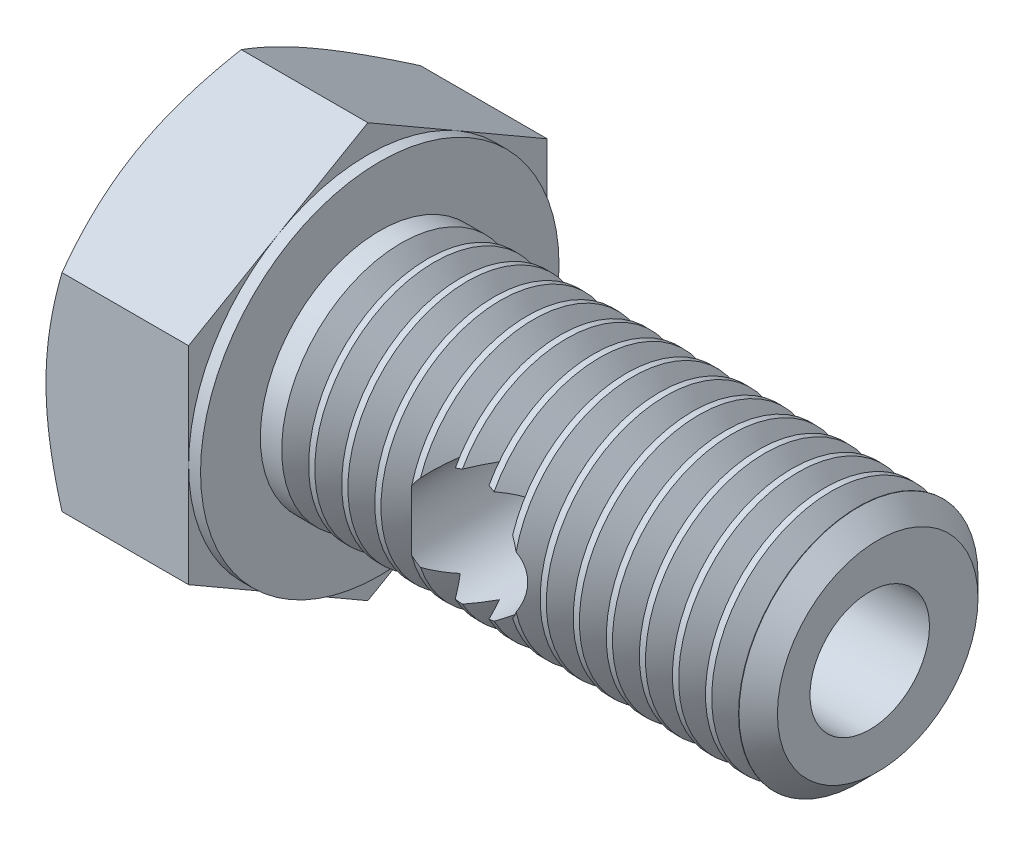
from build123d import *

# Parameters (mm, degrees)
BASEHEAD_DEPTH             = 7.76
INDENT_START               = -0.97
INDENT_2_OUTLINE_R         = 7.875
INDENT_2_DEPTH             = 0.97
SKETCH4_W                  = 0.6
SKETCH4_H                  = 11.392304845
THDSCHPAT_COUNT            = 14
THDSCHPAT_PITCH            = 1.660714286
KES_EKSTR_ZYON1_DEPTH      = 36.527701868
KES_EKSTR_ZYON1_DEPTH_BACK = 36.527701868
IZIM1_R                    = 3
KES_EKSTR_ZYON2_REACH      = 37.528
KES_EKSTR_ZYON2_END_RADIUS = 3
IZIM2_R                    = 3


# Read off the part's stored shape, not the designer's step: Indent
with BuildPart() as part:
    # Sketch1 → BaseHead (new body)
    with BuildSketch(Plane(origin=(0, 0, 0), x_dir=(0, 0, -1), z_dir=(1, 0, 0))):
        Polygon((9, 5.196152423), (9, -5.196152423), (0, -10.392304845), (-9, -5.196152423), (-9, 5.196152423), (0, 10.392304845), align=None)
    extrude(amount=BASEHEAD_DEPTH)

    # Indent outline → Indent (revolve)
    with BuildSketch(Plane.YX):
        Polygon((6, 7.76), (6, 31.796), (5.036, 32.76), (0, 32.76), (0, 7.76), align=None)
    revolve(axis=Axis((0, 0, 0), (1, 0, 0)))

    # Indent 2 outline → Indent 2 (cut)
    with BuildSketch(Plane.ZY.offset(INDENT_START)):
        with Locations((0.033212245, 0.192376607)):
            Circle(INDENT_2_OUTLINE_R)
    extrude(amount=INDENT_2_DEPTH, mode=Mode.SUBTRACT)

    # Sketch3 → HeadChamfer (revolve, cut)
    with BuildSketch(Plane.XY, mode=Mode.PRIVATE) as headchamfer_sk:
        Polygon((0, 9), (3.690598923, 15.392304845), (3.690598923, 20.392304845), (-10, 20.392304845), (-10, 9), align=None)
    revolve(headchamfer_sk.sketch.rotate(Axis((0, 0, 0), (1, 0, 0)), 90), axis=Axis((0, 0, 0), (1, 0, 0)), mode=Mode.SUBTRACT)

    # Sketch4 → BearingFace (revolve, cut)
    with BuildSketch(Plane.XY, mode=Mode.PRIVATE) as bearingface_sk:
        with Locations((7.46, 14.696152423)):
            Rectangle(SKETCH4_W, SKETCH4_H)
    revolve(bearingface_sk.sketch.rotate(Axis((0, 0, 0), (1, 0, 0)), 90), axis=Axis((0, 0, 0), (1, 0, 0)), mode=Mode.SUBTRACT)

    # ThdSchSke → ThreadSchematic (revolve, cut)
    with BuildSketch(Plane.XY):
        Polygon((9.51, -5.036), (8.834999933, -6), (8.834999933, -7.5), (10.185000067, -7.5), (10.185000067, -6), align=None)
    threadschematic = revolve(axis=Axis((-3.175, 0, 0), (1, 0, 0)), mode=Mode.SUBTRACT)

    # ThdSchPat: ThreadSchematic ×14
    with Locations(*[(i * THDSCHPAT_PITCH, 0, 0) for i in range(1, THDSCHPAT_COUNT)]):
        add(threadschematic, mode=Mode.SUBTRACT)

    # Çizim1 → Kes-Ekstrüzyon1 (cut, two sides: drawn at the far end of the back side and taken through both)
    with BuildSketch(Plane.XY.offset(-KES_EKSTR_ZYON1_DEPTH_BACK)):
        with Locations(Location((17.76, 0, 0), (0, 0, 334.158064308))):
            Circle(IZIM1_R)
    extrude(amount=KES_EKSTR_ZYON1_DEPTH + KES_EKSTR_ZYON1_DEPTH_BACK, mode=Mode.SUBTRACT)

    # Kes-Ekstrüzyon2: up to this cylinder (the profile starts outside it)
    kes_ekstr_zyon2_end = Plane(origin=(17.76, 0, 0.400078), z_dir=(0, 0, 1)) * Cylinder(KES_EKSTR_ZYON2_END_RADIUS, 82.056, mode=Mode.PRIVATE)
    # Çizim2 → Kes-Ekstrüzyon2 (cut, up to the surface)
    with BuildSketch(Plane(origin=(32.76, 0, 0), x_dir=(0, 0, -1), z_dir=(1, 0, 0)), mode=Mode.PRIVATE) as kes_ekstr_zyon2_sk1:
        with Locations((-0.400077765, 0)):
            Circle(IZIM2_R)
    kes_ekstr_zyon2_tool1 = extrude(kes_ekstr_zyon2_sk1.sketch, amount=-KES_EKSTR_ZYON2_REACH, mode=Mode.PRIVATE) - kes_ekstr_zyon2_end
    add(kes_ekstr_zyon2_tool1.solids().sort_by_distance((32.76, 0, 0.400078))[0], mode=Mode.SUBTRACT)


solid = part.part
